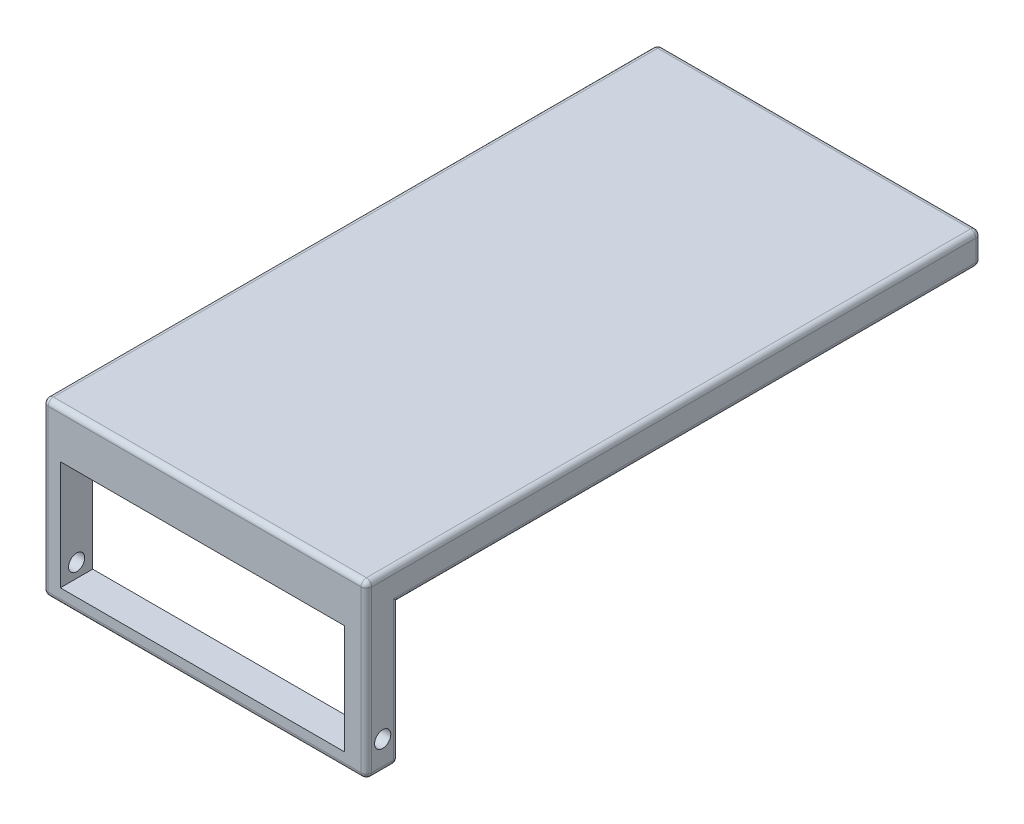
from build123d import *

# Parameters (mm, degrees)
SKETCH1_R           = 12.7
BOSS_EXTRUDE1_DEPTH = 254
FILLET1_R           = 8.382
FILLET2_R           = 8.382
SKETCH6_W           = 445.900168358
SKETCH6_H           = 171.500064753
CUT_EXTRUDE4_DEPTH  = 1009.8530191
SKETCH2_R           = 6.35
CUT_EXTRUDE5_DEPTH  = 38.1


with BuildPart() as part:
    # Sketch1 → Boss-Extrude1 (new, symmetric)
    with BuildSketch(Plane(origin=(0, 0, 0), x_dir=(0, 0, -1), z_dir=(1, 0, 0))):
        Polygon((-50.8, 122.075554067), (914.4, 122.075554067), (914.4, 72.291554067), (0, 72.291554067), (0, -147.164445933), (-50.8, -147.164445933), align=None)
        with Locations((-25.220095835, -101.724479604)):
            Circle(SKETCH1_R, mode=Mode.SUBTRACT)
    extrude(amount=BOSS_EXTRUDE1_DEPTH, both=True)

    # Fillet1
    fillet1_edges = [part.edges().sort_by_distance(p)[0] for p in [
        (0, 122.075554067, 50.8),
        (0, 122.075554067, -914.4),
        (0, 72.291554067, -914.4),
        (0, -147.164445933, 50.8),
        (254, -37.436445933, 0),
        (254, 72.291554067, -457.2),
        (254, 97.183554067, -914.4),
        (254, 122.075554067, -431.8),
        (254, -12.544445933, 50.8),
        (-254, 122.075554067, -431.8),
        (-254, 97.183554067, -914.4),
        (-254, -12.544445933, 50.8),
    ]]
    fillet(fillet1_edges, radius=FILLET1_R)

    # Fillet2
    # the kernel refuses this fillet: 8.382 mm, written as the material it takes off along each edge
    with BuildSketch(Plane(origin=(245.618, -138.782445933, 42.418), x_dir=(0, -1, 0), z_dir=(1, 0, 0))) as fillet2_piece_1_section:
        Polygon((0, 0), (FILLET2_R, 0), (FILLET2_R, -FILLET2_R), (0, -FILLET2_R), align=None)
    fillet2_piece_1 = extrude(amount=FILLET2_R, mode=Mode.PRIVATE)
    fillet2_piece_1 = fillet2_piece_1 - Plane(origin=(245.618, -138.782445933, 42.418), x_dir=(0, 0.7071067811865477, -0.7071067811865474), z_dir=(1, 0, 0)) * Sphere(FILLET2_R, mode=Mode.PRIVATE)
    add(fillet2_piece_1, mode=Mode.SUBTRACT)
    with BuildSketch(Plane(origin=(-245.618, -138.782445933, 42.418), x_dir=(0, -1, 0), z_dir=(-1, 0, 0))) as fillet2_piece_2_section:
        Polygon((0, 0), (FILLET2_R, 0), (FILLET2_R, FILLET2_R), (0, FILLET2_R), align=None)
    fillet2_piece_2 = extrude(amount=FILLET2_R, mode=Mode.PRIVATE)
    fillet2_piece_2 = fillet2_piece_2 - Plane(origin=(-245.618, -138.782445933, 42.418), x_dir=(0, 0.7071067811865477, -0.7071067811865474), z_dir=(-1, 0, 0)) * Sphere(FILLET2_R, mode=Mode.PRIVATE)
    add(fillet2_piece_2, mode=Mode.SUBTRACT)
    with BuildSketch(Plane(origin=(254, -147.164445933, 8.382), x_dir=(0, 1, 0), z_dir=(0, 0, 1))) as fillet2_piece_3:
        with BuildLine():
            CenterArc((FILLET2_R, FILLET2_R), FILLET2_R, 180, 90)
            Line((0, FILLET2_R), (0, 0))
            Line((0, 0), (FILLET2_R, 0))
        make_face()
    extrude(amount=34.036, mode=Mode.SUBTRACT)
    with BuildSketch(Plane(origin=(-254, -147.164445933, -20.955), x_dir=(0, 1, 0), z_dir=(0, 0, 1))) as fillet2_piece_4:
        with BuildLine():
            CenterArc((FILLET2_R, -FILLET2_R), FILLET2_R, 90, 90)
            Line((0, -FILLET2_R), (0, 0))
            Line((0, 0), (FILLET2_R, 0))
        make_face()
    extrude(amount=63.373, mode=Mode.SUBTRACT)
    with BuildSketch(Plane(origin=(-274.955, -147.164445933, 0), x_dir=(0, 1, 0), z_dir=(1, 0, 0))) as fillet2_piece_5:
        with BuildLine():
            CenterArc((FILLET2_R, FILLET2_R), FILLET2_R, 180, 90)
            Line((0, FILLET2_R), (0, 0))
            Line((0, 0), (FILLET2_R, 0))
        make_face()
    extrude(amount=520.573, mode=Mode.SUBTRACT)
    with BuildSketch(Plane(origin=(245.618, -147.164445933, 8.382), x_dir=(1, 0, 0), z_dir=(0, 0, 1))) as fillet2_piece_6:
        with BuildLine():
            CenterArc((8.382 - FILLET2_R, FILLET2_R), FILLET2_R, 270, 90)
            Line((8.382, FILLET2_R), (8.382, 0))
            Line((8.382, 0), (8.382 - FILLET2_R, 0))
        make_face()
    revolve(axis=Axis((245.618, -147.164445933, 8.382), (0, 1, 0)), revolution_arc=90, mode=Mode.SUBTRACT)

    # Sketch6 → Cut-Extrude4 (cut, through all)
    with BuildSketch(Plane.XY.offset(50.8)):
        with Locations((-3.610527679, -37.818139686)):
            Rectangle(SKETCH6_W, SKETCH6_H)
    extrude(amount=-CUT_EXTRUDE4_DEPTH, mode=Mode.SUBTRACT)

    # Sketch2 → Cut-Extrude5 (cut)
    with BuildSketch(Plane.XZ.offset(-72.291554067)):
        with Locations(Location((-127, -787.4, 0), (0, 0, 270))):
            Circle(SKETCH2_R)
        with Locations(Location((127, -787.4, 0), (0, 0, 270))):
            Circle(SKETCH2_R)
    extrude(amount=-CUT_EXTRUDE5_DEPTH, mode=Mode.SUBTRACT)


solid = part.part
